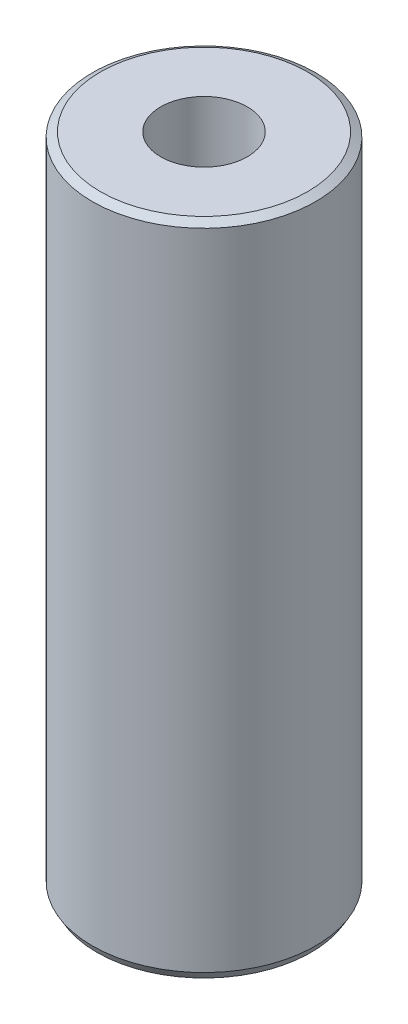
from build123d import *
from OCP.BRepFilletAPI import BRepFilletAPI_MakeChamfer

# Parameters (mm, degrees)
SKETCH1_R           = 5
BOSS_EXTRUDE1_DEPTH = 29.426288318
SKETCH2_R           = 1.940376862
CUT_EXTRUDE1_DEPTH  = 31.263946276
CHAMFER1_SIZE       = 0.207194052
CHAMFER1_SIZE2      = 0.358870626


with BuildPart() as part:
    # Sketch1 → Boss-Extrude1 (new body)
    with BuildSketch(Plane(origin=(0, 0, 0), x_dir=(1, 0, 0), z_dir=(0, 1, 0))):
        Circle(SKETCH1_R)
    extrude(amount=BOSS_EXTRUDE1_DEPTH)

    # Sketch2 → Cut-Extrude1 (cut, through all)
    with BuildSketch(Plane(origin=(0, 0, 0), x_dir=(1, 0, 0), z_dir=(0, 1, 0))):
        Circle(SKETCH2_R)
    extrude(amount=CUT_EXTRUDE1_DEPTH, mode=Mode.SUBTRACT)

    # Chamfer1: one chamfer whose edges measure the first distance from different faces: ONE call of the kernel's chamfer builder (chamfer() names one face for all edges)
    chamfer1_edges_1 = [part.edges().sort_by_distance(p)[0] for p in [
        (-5, 29.426288318, 0),
    ]]
    chamfer1_side_1 = [part.faces().sort_by_distance(p)[0] for p in [
        (-5, 14.713144159, 0),
    ]]
    chamfer1_edges_2 = [part.edges().sort_by_distance(p)[0] for p in [
        (-5, 0, 0),
    ]]
    chamfer1_side_2 = [part.faces().sort_by_distance(p)[0] for p in [
        (-4.858578644, 0, 0),
    ]]
    chamfer1 = BRepFilletAPI_MakeChamfer(part.part.solid().wrapped)
    for e in chamfer1_edges_1:
        chamfer1.Add(CHAMFER1_SIZE, CHAMFER1_SIZE2, e.wrapped, chamfer1_side_1[0].wrapped)  # the first distance lies on this face
    for e in chamfer1_edges_2:
        chamfer1.Add(CHAMFER1_SIZE, CHAMFER1_SIZE2, e.wrapped, chamfer1_side_2[0].wrapped)  # the first distance lies on this face
    add(Compound.cast(chamfer1.Shape()), mode=Mode.REPLACE)


solid = part.part
